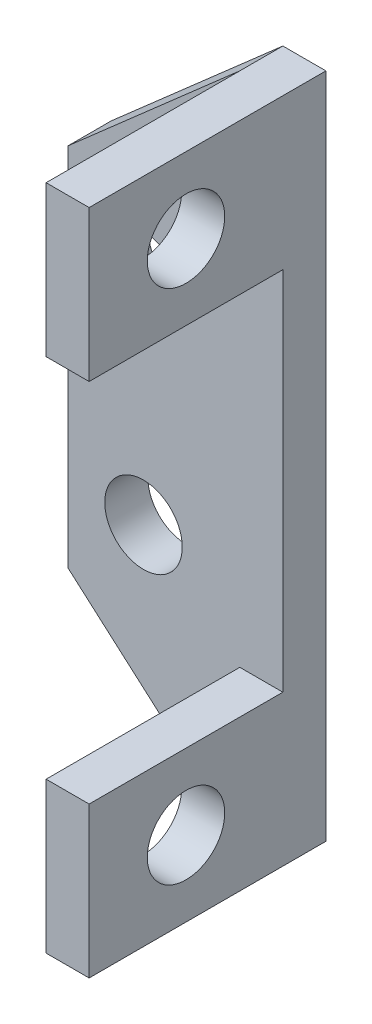
from build123d import *

# Parameters (mm, degrees)
BOSS_EXTRUDE1_DEPTH  = 2
M3_CLEARANCE_HOLE1_D = 3.6
SKETCH6_W            = 2
SKETCH6_H            = 7
BOSS_EXTRUDE2_DEPTH  = 9
M3_CLEARANCE_HOLE2_D = 3.6


with BuildPart() as part:
    # Sketch2 → Boss-Extrude1 (new body)
    with BuildSketch(Plane.XY):
        Polygon((-9.97441, 24), (-9.97441, 7), (-2, 0), (0, 0), (0, 31), (-2, 31), align=None)
    extrude(amount=BOSS_EXTRUDE1_DEPTH)

    # M3 Clearance Hole1 (through all)
    with Locations(Plane.XY.offset(2)):
        with Locations((-6.47441, 10.5), (-6.47441, 20.5)):
            Hole(M3_CLEARANCE_HOLE1_D / 2)

    # Sketch6 → Boss-Extrude2 (add)
    with BuildSketch(Plane.XY.offset(2)):
        with Locations((-1, 27.5)):
            Rectangle(SKETCH6_W, SKETCH6_H)
        with Locations((-1, 3.5)):
            Rectangle(SKETCH6_W, SKETCH6_H)
    extrude(amount=BOSS_EXTRUDE2_DEPTH)

    # M3 Clearance Hole2 (through all)
    with Locations(Plane.ZY.offset(2)):
        with Locations((6.5, 3.5), (6.5, 27.5)):
            Hole(M3_CLEARANCE_HOLE2_D / 2)


solid = part.part
